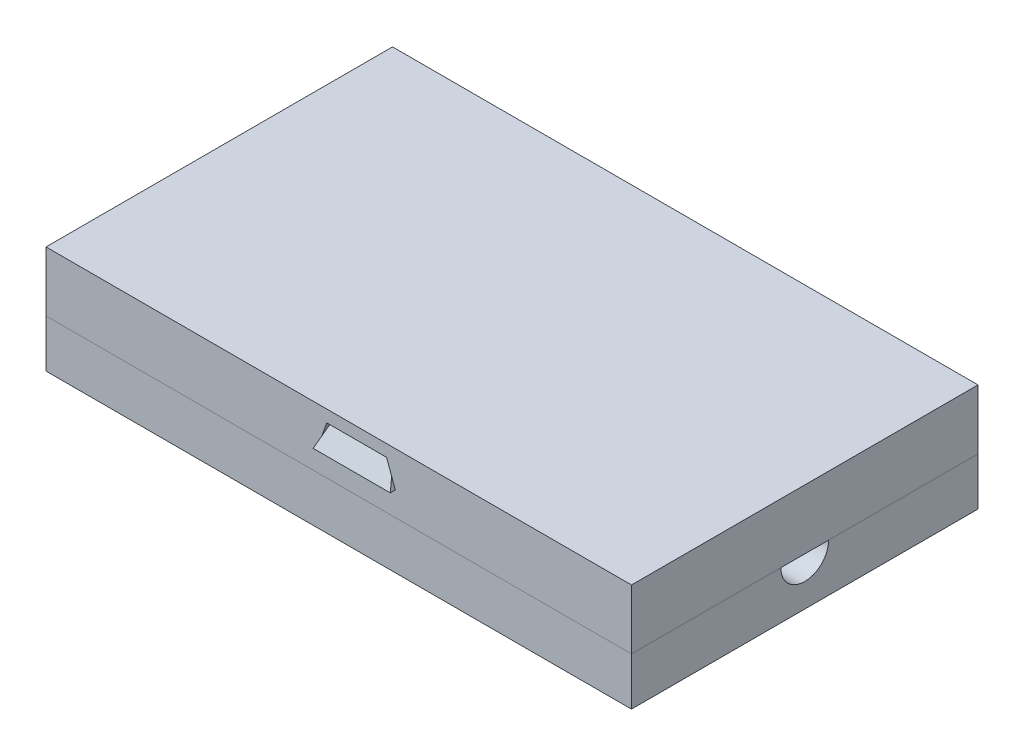
from build123d import *

# Parameters (mm, degrees)
SKETCH1_W            = 49
SKETCH1_H            = 29
SKETCH1_W_2          = 45
SKETCH1_H_2          = 25
EXTRUDE_THIN1_DEPTH  = 4
SKETCH1_2_W          = 45
SKETCH1_2_H          = 25
BOSS_EXTRUDE1_DEPTH  = 2
SKETCH2_W            = 8
SKETCH2_H            = 8
CUT_EXTRUDE1_DEPTH   = 29.539446386
CUT_EXTRUDE2_REACH   = 53.257
SKETCH3_R            = 2
SNAP_START           = -13.918963426
SNAP_HOOK1_DEPTH     = 2
SNAP_START_2         = -1.722964232
SNAP_HOOK1_2_DEPTH   = 6.455880937
SNAP_START_3         = -16
SNAP_HOOK1_3_DEPTH   = 2.081036574
SNAP_START_4         = -12.5
SNAP_HOOK1_4_DEPTH   = 0.581036574
SKETCH4_W            = 49
SKETCH4_H            = 29
SKETCH4_W_2          = 45
SKETCH4_H_2          = 25
EXTRUDE_THIN2_DEPTH  = 5
SNAP_GROOVE1_DEPTH   = 1.418963426
SNAP_START_5         = -14.5
SNAP_GROOVE1_2_DEPTH = 0.581036574
SKETCH5_W            = 49
SKETCH5_H            = 29
BOSS_EXTRUDE2_DEPTH  = 1


with BuildPart() as part:
    # Sketch1 → Extrude-Thin1 (new body)
    with BuildSketch(Plane(origin=(0, 0, 0), x_dir=(1, 0, 0), z_dir=(0, 1, 0))):
        Rectangle(SKETCH1_W, SKETCH1_H)
        Rectangle(SKETCH1_W_2, SKETCH1_H_2, mode=Mode.SUBTRACT)
    extrude(amount=EXTRUDE_THIN1_DEPTH)

    # Sketch1<2> → Boss-Extrude1 (add)
    with BuildSketch(Plane(origin=(0, 0, 0), x_dir=(1, 0, 0), z_dir=(0, 1, 0))):
        Rectangle(SKETCH1_2_W, SKETCH1_2_H)
    extrude(amount=BOSS_EXTRUDE1_DEPTH)

    # Sketch2 → Cut-Extrude1 (cut, through all)
    with BuildSketch(Plane(origin=(0, 2, 0), x_dir=(1, 0, 0), z_dir=(0, 1, 0))):
        with Locations((-10, 0)):
            Rectangle(SKETCH2_W, SKETCH2_H)
        with Locations((10, 0)):
            Rectangle(SKETCH2_W, SKETCH2_H)
    extrude(amount=-CUT_EXTRUDE1_DEPTH, mode=Mode.SUBTRACT)

    # Sketch3 → Cut-Extrude2 (cut, up to next)
    with BuildSketch(Plane(origin=(24.5, 0, 0), x_dir=(0, 0, -1), z_dir=(1, 0, 0)), mode=Mode.PRIVATE) as cut_extrude2_sk1:
        with Locations((0, 4)):
            Circle(SKETCH3_R)
    cut_extrude2_tool1 = extrude(cut_extrude2_sk1.sketch, amount=-CUT_EXTRUDE2_REACH, mode=Mode.PRIVATE) & part.part
    add(cut_extrude2_tool1.solids().sort_by_distance((24.5, 4, 0))[0], mode=Mode.SUBTRACT)

    # Snap Hook1: read off the stored shape, not the designer's step
    # Snap Hook1 outline → Snap Hook1 (add)
    with BuildSketch(Plane.XY.offset(SNAP_START)):
        Polygon((4.004976236, 8), (-0.995023764, 8), (-2.450904701, 4), (5.460857173, 4), align=None)
    snap_hook1 = extrude(amount=SNAP_HOOK1_DEPTH)

    # Snap Hook1 2 outline → Snap Hook1 2 (add)
    with BuildSketch(Plane.YZ.offset(SNAP_START_2)):
        Polygon((6, -13.918963426), (6, -14.918963426), (8, -13.918963426), align=None)
    snap_hook1_2 = extrude(amount=SNAP_HOOK1_2_DEPTH)

    # Snap Hook1 3 outline → Snap Hook1 3 (cut)
    with BuildSketch(Plane.XY.offset(SNAP_START_3)):
        Polygon((4.004976236, 8), (4.732916705, 6), (4.732916705, 9), (3.641006002, 9), align=None)
        Polygon((-1.722964232, 9), (-1.722964232, 6), (-0.995023764, 8), (-0.63105353, 9), align=None)
    snap_hook1_3 = extrude(amount=SNAP_HOOK1_3_DEPTH, mode=Mode.SUBTRACT)

    # Snap Hook1 4 outline → Snap Hook1 4 (add)
    with BuildSketch(Plane.XY.offset(SNAP_START_4)):
        Polygon((6.552767876, 1), (6.188797642, 2), (5.460857173, 4), (-2.450904701, 4), (-3.178845169, 2), (-3.542815403, 1), align=None)
    snap_hook1_4 = extrude(amount=SNAP_HOOK1_4_DEPTH)

    # Mirror3: Snap Hook1, Snap Hook1 2 across plane
    add(snap_hook1.mirror(Plane.XY))
    add(snap_hook1_2.mirror(Plane.XY))

    # Mirror3 2: Snap Hook1 3 across plane
    add(snap_hook1_3.mirror(Plane.XY), mode=Mode.SUBTRACT)

    # Mirror3 3: Snap Hook1 4 across plane
    add(snap_hook1_4.mirror(Plane.XY))


with BuildPart() as body_2:
    # Sketch4 → Extrude-Thin2 (new body)
    with BuildSketch(Plane(origin=(0, 4, 0), x_dir=(1, 0, 0), z_dir=(0, 1, 0))):
        Rectangle(SKETCH4_W, SKETCH4_H)
        Rectangle(SKETCH4_W_2, SKETCH4_H_2, mode=Mode.SUBTRACT)
    extrude(amount=EXTRUDE_THIN2_DEPTH)

    # Snap Groove1: read off the stored shape, not the designer's step
    # Snap Groove1 outline → Snap Groove1 (cut)
    with BuildSketch(Plane.XY.offset(SNAP_START)):
        Polygon((-0.995023764, 8), (-2.450904701, 4), (5.460857173, 4), (4.004976236, 8), align=None)
    snap_groove1 = extrude(amount=SNAP_GROOVE1_DEPTH, mode=Mode.SUBTRACT)

    # Snap Groove1 2 outline → Snap Groove1 2 (cut)
    with BuildSketch(Plane.XY.offset(SNAP_START_5)):
        Polygon((-0.995023764, 8), (-1.722964232, 6), (4.732916705, 6), (4.004976236, 8), align=None)
    snap_groove1_2 = extrude(amount=SNAP_GROOVE1_2_DEPTH, mode=Mode.SUBTRACT)

    # Mirror4: Snap Groove1, Snap Groove1 2 across plane
    add(snap_groove1.mirror(Plane.XY), mode=Mode.SUBTRACT)
    add(snap_groove1_2.mirror(Plane.XY), mode=Mode.SUBTRACT)

    # Sketch5 → Boss-Extrude2 (add)
    with BuildSketch(Plane(origin=(0, 9, 0), x_dir=(1, 0, 0), z_dir=(0, 1, 0))):
        Rectangle(SKETCH5_W, SKETCH5_H)
    extrude(amount=-BOSS_EXTRUDE2_DEPTH)


solid = Compound([part.part, body_2.part])
